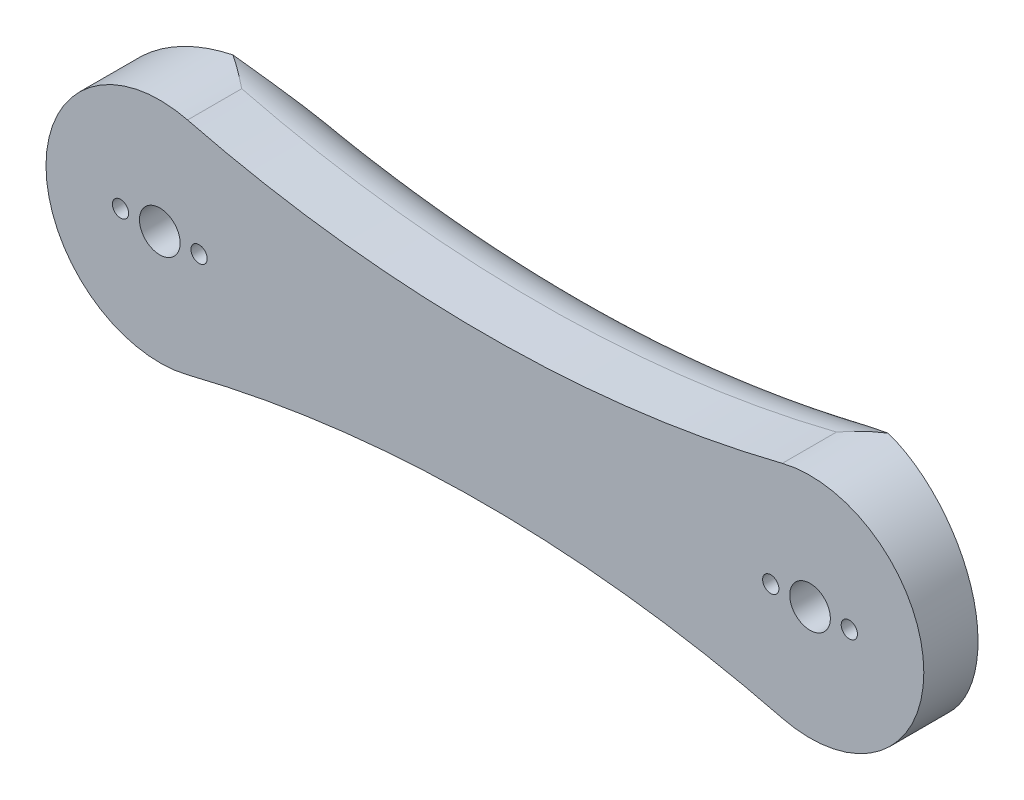
from build123d import *

# Parameters (mm, degrees)
SALIENTE_EXTRUIR1_DEPTH    = 20
CORTAR_EXTRUIR1_DEPTH      = 87.034876649
CORTAR_EXTRUIR1_DEPTH_BACK = 87.034876649
CROQUIS4_R                 = 18
CORTAR_EXTRUIR2_DEPTH      = 14
CROQUIS5_R                 = 3.75
CROQUIS5_R_2               = 1.5
CORTAR_EXTRUIR3_DEPTH      = 85.841027952
REDONDEO1_R                = 10
CORTAR_EXTRUIR4_DEPTH      = 47


with BuildPart() as part:
    # Croquis1 → Saliente-Extruir1 (new body)
    with BuildSketch(Plane.XY):
        with BuildLine():
            ThreePointArc((54.87804878, 20.365795239), (0, 13.570744225), (-54.87804878, 20.365795239))
            ThreePointArc((-54.87804878, 20.365795239), (-81, 0), (-54.87804878, -20.365795239))
            ThreePointArc((-54.87804878, -20.365795239), (0, -13.570744225), (54.87804878, -20.365795239))
            ThreePointArc((54.87804878, -20.365795239), (81, 0), (54.87804878, 20.365795239))
        make_face()
    extrude(amount=-SALIENTE_EXTRUIR1_DEPTH)

    # Croquis2 → Cortar-Extruir1 (cut, two sides: drawn at the far end of the back side and taken through both)
    with BuildSketch(Plane(origin=(0, 0, 0), x_dir=(1, 0, 0), z_dir=(0, 1, 0)).offset(-CORTAR_EXTRUIR1_DEPTH_BACK)):
        with BuildLine():
            Line((-81, 10), (-81, 20))
            Line((-81, 20), (-39, 20))
            ThreePointArc((-39, 20), (-59.790503904, 14.120116398), (-81, 10))
        make_face()
        with BuildLine():
            Line((81, 10), (81, 20))
            Line((81, 20), (39, 20))
            ThreePointArc((39, 20), (59.790503904, 14.120116398), (81, 10))
        make_face()
    extrude(amount=CORTAR_EXTRUIR1_DEPTH + CORTAR_EXTRUIR1_DEPTH_BACK, mode=Mode.SUBTRACT)

    # Croquis4 → Cortar-Extruir2 (cut)
    with BuildSketch(Plane(origin=(0, 0, -20), x_dir=(-1, 0, 0), z_dir=(0, 0, -1))):
        with Locations((60, 0)):
            Circle(CROQUIS4_R)
        with Locations((-60, 0)):
            Circle(CROQUIS4_R)
    extrude(amount=-CORTAR_EXTRUIR2_DEPTH, mode=Mode.SUBTRACT)

    # Croquis5 → Cortar-Extruir3 (cut, through all)
    with BuildSketch(Plane(origin=(0, 0, -6), x_dir=(-1, 0, 0), z_dir=(0, 0, -1))):
        with Locations((60, 0)):
            Circle(CROQUIS5_R)
        with Locations((67.25, 0)):
            Circle(CROQUIS5_R_2)
        with Locations(Location((52.75, 0, 0), (0, 0, 180))):
            Circle(CROQUIS5_R_2)
        with Locations(Location((-67.25, 0, 0), (0, 0, 180))):
            Circle(CROQUIS5_R_2)
        with Locations(Location((-60, 0, 0), (0, 0, 180))):
            Circle(CROQUIS5_R)
        with Locations((-52.75, 0)):
            Circle(CROQUIS5_R_2)
    extrude(amount=-CORTAR_EXTRUIR3_DEPTH, mode=Mode.SUBTRACT)

    # Redondeo1
    # the kernel refuses this fillet: 10 mm, written as the material it takes off along each edge
    with BuildSketch(Plane(origin=(0, -238.570744225, -20), x_dir=(-0.28147080374244887, 0.9595697924802447, 0), z_dir=(-0.9595697924802447, -0.28147080374244887, 0))) as redondeo1_piece_1:
        with BuildLine():
            CenterArc((225 + REDONDEO1_R, -REDONDEO1_R), REDONDEO1_R, 90, 90)
            Line((225, -REDONDEO1_R), (225, 0))
            Line((225, 0), (225 + REDONDEO1_R, 0))
        make_face()
    revolve(axis=Axis((0, -238.570744225, -20), (0, 0, -1)), revolution_arc=32.696012994, mode=Mode.SUBTRACT)
    with BuildSketch(Plane(origin=(0, 238.570744225, -20), x_dir=(0.28147080374244876, -0.9595697924802447, 0), z_dir=(0.9595697924802447, 0.28147080374244876, 0))) as redondeo1_piece_2:
        with BuildLine():
            CenterArc((225 + REDONDEO1_R, -REDONDEO1_R), REDONDEO1_R, 90, 90)
            Line((225 + REDONDEO1_R, 0), (225, 0))
            Line((225, 0), (225, -REDONDEO1_R))
        make_face()
    revolve(axis=Axis((0, 238.570744225, -20), (0, 0, -1)), revolution_arc=32.696012994, mode=Mode.SUBTRACT)

    # Croquis6 → Cortar-Extruir4 (cut, symmetric)
    with BuildSketch(Plane(origin=(0, 0, 0), x_dir=(0, 0, -1), z_dir=(1, 0, 0))):
        with BuildLine():
            Line((6, 5.5), (6, -5.5))
            ThreePointArc((6, -5.5), (13, 0), (6, 5.5))
        make_face()
    extrude(amount=CORTAR_EXTRUIR4_DEPTH, both=True, mode=Mode.SUBTRACT)


solid = part.part
